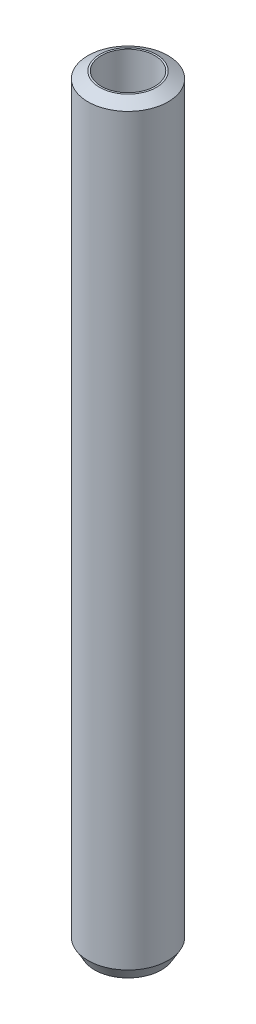
from build123d import *
from OCP.BRepFilletAPI import BRepFilletAPI_MakeChamfer

# Parameters (mm, degrees)
SKETCH1_R           = 12.5
BOSS_EXTRUDE1_DEPTH = 237.604769343
SKETCH2_R           = 8.329472663
CUT_EXTRUDE1_DEPTH  = 239.261466492
CHAMFER1_SIZE       = 2.094808408
CHAMFER1_SIZE2      = 3.628314596


with BuildPart() as part:
    # Sketch1 → Boss-Extrude1 (new body)
    with BuildSketch(Plane(origin=(0, 0, 0), x_dir=(1, 0, 0), z_dir=(0, 1, 0))):
        Circle(SKETCH1_R)
    extrude(amount=BOSS_EXTRUDE1_DEPTH)

    # Sketch2 → Cut-Extrude1 (cut, through all)
    with BuildSketch(Plane(origin=(0, 0, 0), x_dir=(1, 0, 0), z_dir=(0, 1, 0))):
        Circle(SKETCH2_R)
    extrude(amount=CUT_EXTRUDE1_DEPTH, mode=Mode.SUBTRACT)

    # Chamfer1: one chamfer whose edges measure the first distance from different faces: ONE call of the kernel's chamfer builder (chamfer() names one face for all edges)
    chamfer1_edges_1 = [part.edges().sort_by_distance(p)[0] for p in [
        (-12.5, 237.604769343, 0),
    ]]
    chamfer1_side_1 = [part.faces().sort_by_distance(p)[0] for p in [
        (-12.5, 118.802384672, 0),
    ]]
    chamfer1_edges_2 = [part.edges().sort_by_distance(p)[0] for p in [
        (-12.5, 0, 0),
    ]]
    chamfer1_side_2 = [part.faces().sort_by_distance(p)[0] for p in [
        (-12.146446609, 0, 0),
    ]]
    chamfer1 = BRepFilletAPI_MakeChamfer(part.part.solid().wrapped)
    for e in chamfer1_edges_1:
        chamfer1.Add(CHAMFER1_SIZE, CHAMFER1_SIZE2, e.wrapped, chamfer1_side_1[0].wrapped)  # the first distance lies on this face
    for e in chamfer1_edges_2:
        chamfer1.Add(CHAMFER1_SIZE, CHAMFER1_SIZE2, e.wrapped, chamfer1_side_2[0].wrapped)  # the first distance lies on this face
    add(Compound.cast(chamfer1.Shape()), mode=Mode.REPLACE)


solid = part.part
